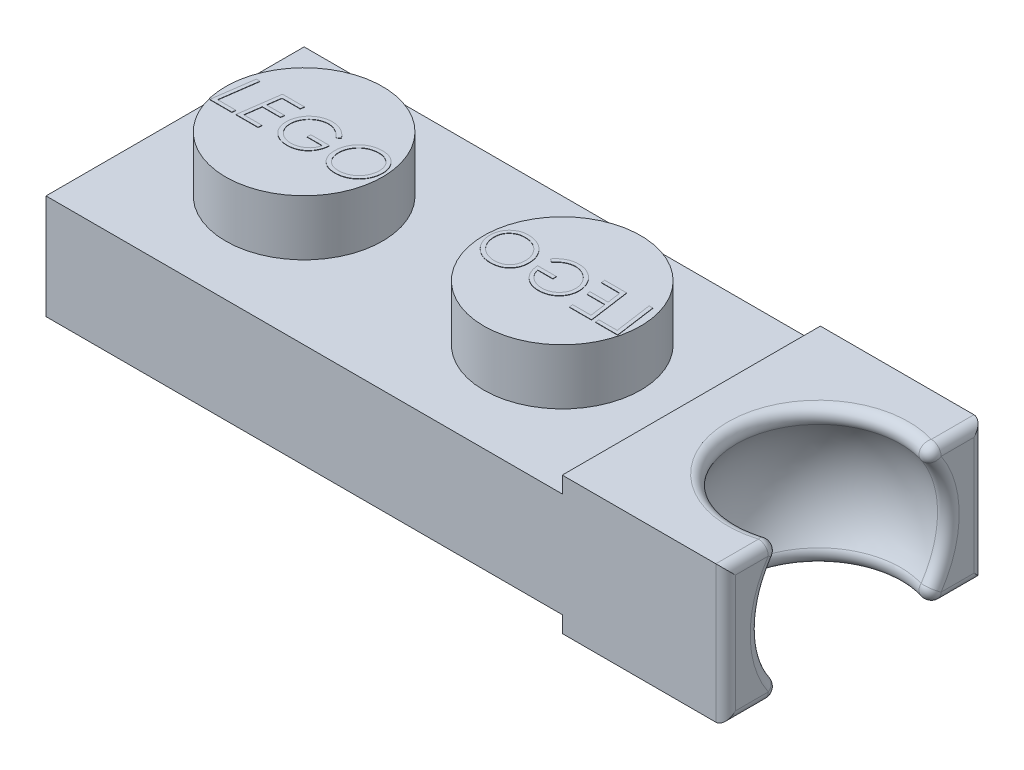
from build123d import *

# Parameters (mm, degrees)
SKETCH1_W           = 7.9
SKETCH1_H           = 7.9
BOSS_EXTRUDE1_DEPTH = 3.2
SKETCH2_R           = 2.4
BOSS_EXTRUDE2_DEPTH = 1.7
BOSS_EXTRUDE4_DEPTH = 0.01
SKETCH4_W           = 6.679581062
SKETCH4_H           = 6.679581062
CUT_EXTRUDE1_DEPTH  = 2.01
BOSS_EXTRUDE5_START = -2.01
SKETCH5_R           = 1.021947204
SKETCH5_R_2         = 1.041114876
SKETCH5_R_3         = 1.016069602
BOSS_EXTRUDE5_DEPTH = 2.01
SKETCH6_W           = 7.9
SKETCH6_H           = 4.2
BOSS_EXTRUDE6_DEPTH = 5
FILLET1_R           = 0.3


with BuildPart() as part:
    # Sketch1 → Boss-Extrude1 (new body)
    with BuildSketch(Plane(origin=(0, 0, 0), x_dir=(1, 0, 0), z_dir=(0, 1, 0))):
        with Locations((3.95, 3.95)):
            Rectangle(SKETCH1_W, SKETCH1_H)
    extrude(amount=BOSS_EXTRUDE1_DEPTH)

    # Sketch2 → Boss-Extrude2 (add)
    with BuildSketch(Plane(origin=(0, 3.2, 0), x_dir=(1, 0, 0), z_dir=(0, 1, 0))):
        with Locations((3.95, 3.95)):
            Circle(SKETCH2_R)
    extrude(amount=BOSS_EXTRUDE2_DEPTH)

    # Sketch3 → Boss-Extrude4 (add)
    # profile 1 of 4: a face of its own
    with BuildSketch(Plane(origin=(0, 4.9, 0), x_dir=(1, 0, 0), z_dir=(0, 1, 0))):
        Polygon((1.832282536, 4.604898123), (1.945463626, 4.604898123), (1.785708017, 3.46707761), (2.346104652, 3.46707761), (2.331831815, 3.354898123), (1.657002088, 3.354898123), align=None)
    # profile 2 of 4: a face of its own
    with BuildSketch(Plane(origin=(0, 4.9, 0), x_dir=(1, 0, 0), z_dir=(0, 1, 0))):
        Polygon((3.307643113, 4.604898123), (3.289864668, 4.492718636), (2.730720036, 4.492718636), (2.672376687, 4.076051969), (3.227514908, 4.076051969), (3.211489267, 3.963872482), (2.656351046, 3.963872482), (2.586990069, 3.46707761), (3.147386703, 3.46707761), (3.132863466, 3.354898123), (2.458284139, 3.354898123), (2.633564588, 4.604898123), align=None)
    # profile 3 of 4: a face of its own
    with BuildSketch(Plane(origin=(0, 4.9, 0), x_dir=(1, 0, 0), z_dir=(0, 1, 0))):
        with BuildLine():
            Line((4.701873883, 4.341727049), (4.602214428, 4.268359661))
            add(Edge.make_bspline(
                [(4.602214428, 4.268359661), (4.594223081, 4.278463296), (4.578382454, 4.298490949), (4.552974208, 4.326751799), (4.526781942, 4.353389692), (4.49925824, 4.377917229), (4.471083571, 4.40112998), (4.441525281, 4.42204341), (4.410978563, 4.441207159), (4.379659496, 4.458649755), (4.347610579, 4.474125482), (4.315396207, 4.487732834), (4.282869127, 4.498922357), (4.250283005, 4.50864136), (4.217299487, 4.51587276), (4.18414763, 4.520710487), (4.150903008, 4.524293062), (4.128633082, 4.524610402), (4.117438786, 4.524769918)],
                knots=[0, 0, 0, 0, 1.088205139, 2.157064813, 3.209299296, 4.24303109, 5.270682624, 6.292193363, 7.299904734, 8.316436989, 9.319473328, 10.305733085, 11.269264382, 12.22444877, 13.177574148, 14.119122834, 15.054550362, 16, 16, 16, 16], degree=3))
            add(Edge.make_bspline(
                [(4.117438786, 4.524769918), (4.104994375, 4.524521107), (4.080132736, 4.524024028), (4.043033101, 4.520256885), (4.006376299, 4.51354748), (3.969908323, 4.504926578), (3.933893833, 4.493301772), (3.898252767, 4.479273564), (3.86309309, 4.462612711), (3.828430169, 4.443710217), (3.794953431, 4.422557236), (3.762954424, 4.399818018), (3.733183783, 4.375017311), (3.704650221, 4.34913067), (3.678490591, 4.320990985), (3.654040353, 4.291325456), (3.631570613, 4.259970376), (3.610753816, 4.22729124), (3.592321888, 4.193377608), (3.576332398, 4.158696131), (3.562301633, 4.123622124), (3.551463822, 4.087613068), (3.542488613, 4.051135011), (3.536702509, 4.013925289), (3.532682003, 3.976230124), (3.532229884, 3.950862463), (3.532002088, 3.938081216)],
                knots=[0, 0, 0, 0, 0.97704485, 1.95195533, 2.923843304, 3.901415526, 4.89212417, 5.89249681, 6.906854198, 7.94508701, 8.99059592, 10.014519948, 11.024825533, 12.031297736, 13.037428488, 14.038509295, 15.047964276, 16.064309815, 17.079005887, 18.075937854, 19.061713623, 20.042247028, 21.026191147, 22.008802999, 22.996754876, 24, 24, 24, 24], degree=3))
            add(Edge.make_bspline(
                [(3.532002088, 3.938081216), (3.532369323, 3.920940483), (3.533092921, 3.887166428), (3.54080397, 3.83756171), (3.552297071, 3.789703796), (3.569345009, 3.743984102), (3.590663785, 3.700113704), (3.616898701, 3.658340736), (3.647995923, 3.618632516), (3.683169388, 3.581124089), (3.721975609, 3.547190184), (3.762989457, 3.517071082), (3.806208637, 3.491553815), (3.851780792, 3.471217023), (3.899058754, 3.454481236), (3.948703848, 3.443615036), (4.000192874, 3.436168993), (4.035279814, 3.435410998), (4.053085822, 3.435026328)],
                knots=[0, 0, 0, 0, 1.019699772, 2.00921373, 2.981850619, 3.945611549, 4.907936516, 5.881372837, 6.876399243, 7.906447893, 8.938173367, 9.941073143, 10.932270214, 11.919723139, 12.908225854, 13.912405215, 14.940582182, 16, 16, 16, 16], degree=3))
            add(Edge.make_bspline(
                [(4.053085822, 3.435026328), (4.074581254, 3.435599426), (4.11748625, 3.436743331), (4.180872469, 3.447608002), (4.243162184, 3.464003995), (4.303115661, 3.48756372), (4.359892332, 3.516274774), (4.411741714, 3.54979345), (4.457784869, 3.587961635), (4.498384943, 3.630580026), (4.53303885, 3.678554542), (4.563120551, 3.731230233), (4.587740602, 3.789373269), (4.599634966, 3.830601123), (4.605720036, 3.851692995)],
                knots=[0, 0, 0, 0, 1.033792167, 2.063454529, 3.086685911, 4.12966393, 5.157365104, 6.144632769, 7.094686579, 8.02963692, 8.969786061, 9.935985671, 10.944065236, 12, 12, 12, 12], degree=3))
            Line((4.605720036, 3.851692995), (4.140976447, 3.851692995))
            Line((4.140976447, 3.851692995), (4.140976447, 3.963872482))
            Line((4.140976447, 3.963872482), (4.717899524, 3.963872482))
            add(Edge.make_bspline(
                [(4.717899524, 3.963872482), (4.715864452, 3.940537279), (4.711874195, 3.894782885), (4.69942647, 3.828086612), (4.68199329, 3.764774229), (4.659173945, 3.704861641), (4.630919519, 3.648505742), (4.59774963, 3.595348644), (4.559285746, 3.545571633), (4.515814341, 3.499721655), (4.46844757, 3.458302738), (4.417878433, 3.421925394), (4.364351012, 3.391393009), (4.308182236, 3.366007973), (4.248908241, 3.346854494), (4.187007442, 3.33278705), (4.12217798, 3.324364805), (4.078067373, 3.323359246), (4.055589828, 3.322846841)],
                knots=[0, 0, 0, 0, 1.098006248, 2.152910829, 3.176693714, 4.174102283, 5.154427425, 6.128677043, 7.108165613, 8.099464247, 9.087077226, 10.054952015, 11.015803916, 11.972468591, 12.940477937, 13.931877037, 14.946141749, 16, 16, 16, 16], degree=3))
            add(Edge.make_bspline(
                [(4.055589828, 3.322846841), (4.032525547, 3.323342362), (3.987411429, 3.324311611), (3.9214857, 3.332876212), (3.858807865, 3.34620412), (3.799404334, 3.365318809), (3.743277296, 3.389857102), (3.690679177, 3.420179827), (3.641268759, 3.455657405), (3.595689928, 3.496348401), (3.554559756, 3.541197331), (3.518567584, 3.589307242), (3.487743642, 3.639999747), (3.462901044, 3.693721351), (3.443468533, 3.750181555), (3.429856098, 3.809437188), (3.421311108, 3.871476007), (3.420325278, 3.913764014), (3.419822601, 3.935326809)],
                knots=[0, 0, 0, 0, 1.117903688, 2.186638197, 3.21780727, 4.221242465, 5.20706516, 6.182431358, 7.159609539, 8.151436913, 9.139682433, 10.10533578, 11.060397566, 12.011007066, 12.969638005, 13.950363306, 14.954883424, 16, 16, 16, 16], degree=3))
            add(Edge.make_bspline(
                [(3.419822601, 3.935326809), (3.420138952, 3.950859376), (3.420767729, 3.981731803), (3.424963713, 4.027616327), (3.432679126, 4.072646659), (3.442852825, 4.116910735), (3.455965552, 4.160496846), (3.471933961, 4.20328178), (3.491087489, 4.245242481), (3.513047729, 4.286115161), (3.537530339, 4.325600602), (3.564271155, 4.363247138), (3.593498243, 4.398542313), (3.624507556, 4.432098501), (3.658146201, 4.463054417), (3.693847346, 4.491888255), (3.731480716, 4.518905381), (3.77142415, 4.543221398), (3.812846375, 4.565137356), (3.855118915, 4.584605211), (3.898469674, 4.600573637), (3.942428974, 4.613905323), (3.987291028, 4.624144078), (4.032916476, 4.631801844), (4.079465257, 4.63599767), (4.110753822, 4.636631416), (4.12645321, 4.636949405)],
                knots=[0, 0, 0, 0, 1.01034602, 2.008157081, 2.993527994, 3.979930372, 4.960683832, 5.951959865, 6.948100503, 7.958563211, 8.967975239, 9.968308804, 10.959584837, 11.946808627, 12.938010319, 13.930059161, 14.930392727, 15.949048275, 16.969091794, 17.977364349, 18.973726886, 19.971641333, 20.963333569, 21.964771492, 22.978801278, 24, 24, 24, 24], degree=3))
            add(Edge.make_bspline(
                [(4.12645321, 4.636949405), (4.140647989, 4.63666956), (4.168739982, 4.636115737), (4.210476499, 4.63288549), (4.251380819, 4.627152534), (4.29129634, 4.618801418), (4.330484053, 4.608567941), (4.368675988, 4.59577053), (4.406070924, 4.580754735), (4.442474857, 4.563343269), (4.478143584, 4.543914061), (4.512619765, 4.521658579), (4.546625807, 4.497640881), (4.579591338, 4.471153536), (4.611552577, 4.442077414), (4.642675265, 4.410871755), (4.673242279, 4.377555225), (4.692243855, 4.353777591), (4.701873883, 4.341727049)],
                knots=[0, 0, 0, 0, 1.015105213, 2.008930748, 2.991454354, 3.966534974, 4.923490216, 5.886087319, 6.844809209, 7.803252371, 8.770243484, 9.747130909, 10.735853235, 11.746297741, 12.768902994, 13.824016992, 14.897208497, 16, 16, 16, 16], degree=3))
        make_face()
    # profile 4 of 4: a face of its own
    with BuildSketch(Plane(origin=(0, 4.9, 0), x_dir=(1, 0, 0), z_dir=(0, 1, 0))):
        with BuildLine():
            add(Edge.make_bspline(
                [(5.671925966, 4.636949405), (5.692400623, 4.63650345), (5.732667893, 4.635626396), (5.791703582, 4.627669814), (5.84816478, 4.614697282), (5.901922783, 4.596339067), (5.953136821, 4.572927607), (6.001690741, 4.544284414), (6.047399306, 4.510158163), (6.09025375, 4.471611385), (6.129154607, 4.429051867), (6.163160058, 4.383201547), (6.192058383, 4.334734533), (6.215910086, 4.283554512), (6.233823478, 4.229366588), (6.246743033, 4.172603876), (6.255145963, 4.113110877), (6.255950492, 4.072491917), (6.256361062, 4.051763107)],
                knots=[0, 0, 0, 0, 1.061681398, 2.087996504, 3.083659545, 4.062660971, 5.02945529, 5.999994507, 6.981138296, 7.983640916, 8.985844288, 9.966988076, 10.939736476, 11.908342154, 12.890058995, 13.894159216, 14.925339913, 16, 16, 16, 16], degree=3))
            add(Edge.make_bspline(
                [(6.256361062, 4.051763107), (6.25623821, 4.038988627), (6.255995471, 4.01374805), (6.253408976, 3.976225127), (6.249128591, 3.939561124), (6.243455349, 3.903597875), (6.235835613, 3.868539787), (6.226924527, 3.834140064), (6.216051359, 3.800598383), (6.20384118, 3.767696929), (6.189792262, 3.735595516), (6.173946521, 3.704324105), (6.15669213, 3.673663515), (6.137607818, 3.643838863), (6.11686312, 3.614849105), (6.094393683, 3.586665409), (6.070489857, 3.559187301), (6.044887258, 3.532733386), (6.018336956, 3.507212599), (5.990529993, 3.48355884), (5.962091012, 3.461350566), (5.932834084, 3.440746086), (5.90250067, 3.422121085), (5.871581935, 3.404690573), (5.839905885, 3.388861691), (5.807185809, 3.375183309), (5.773789823, 3.362832151), (5.739620564, 3.352089492), (5.704582969, 3.343076229), (5.668762424, 3.335500733), (5.632062087, 3.329787275), (5.594535036, 3.325855801), (5.556279304, 3.323200874), (5.530454147, 3.322965537), (5.51742877, 3.322846841)],
                knots=[0, 0, 0, 0, 1.057694632, 2.089855924, 3.112648636, 4.113725536, 5.103331559, 6.082381806, 7.055068159, 8.021768845, 8.98743121, 9.954922249, 10.923671581, 11.89959402, 12.885451751, 13.874212627, 14.883322035, 15.900071676, 16.921812937, 17.931632203, 18.921551953, 19.909055848, 20.892997665, 21.867769094, 22.84762411, 23.823252803, 24.802912784, 25.795362855, 26.787788858, 27.797679081, 28.826061376, 29.861826465, 30.921574152, 32, 32, 32, 32], degree=3))
            add(Edge.make_bspline(
                [(5.51742877, 3.322846841), (5.495540081, 3.323312388), (5.45279647, 3.324221496), (5.390401025, 3.331753811), (5.331466149, 3.34468508), (5.275615882, 3.361975519), (5.223270197, 3.38492417), (5.174339628, 3.412892082), (5.128783581, 3.445910526), (5.086763869, 3.483632016), (5.049135515, 3.525626819), (5.016044394, 3.570822838), (4.988418107, 3.619388761), (4.96538613, 3.670881503), (4.948106883, 3.725740589), (4.935156589, 3.783416472), (4.927613141, 3.844314319), (4.926699871, 3.88597706), (4.926232857, 3.907281937)],
                knots=[0, 0, 0, 0, 1.121422378, 2.189881799, 3.214223923, 4.209829567, 5.180887389, 6.136870002, 7.092517675, 8.058664933, 9.02481219, 9.976998316, 10.923432162, 11.882748215, 12.86205079, 13.865508147, 14.908495107, 16, 16, 16, 16], degree=3))
            add(Edge.make_bspline(
                [(4.926232857, 3.907281937), (4.92651465, 3.92390256), (4.927073619, 3.956871533), (4.931757127, 4.005792823), (4.939128338, 4.053761359), (4.950024433, 4.100549976), (4.963594459, 4.14639076), (4.979990494, 4.191253803), (5.000003008, 4.234848241), (5.022452359, 4.277389438), (5.047513645, 4.318359564), (5.07559856, 4.356880644), (5.105216605, 4.393691441), (5.137816677, 4.42780852), (5.172496353, 4.459796588), (5.209524734, 4.489546335), (5.248906172, 4.516814917), (5.290422211, 4.541753927), (5.333531205, 4.564369022), (5.378335052, 4.583562961), (5.424193072, 4.600182058), (5.471345954, 4.613795807), (5.519847317, 4.623918047), (5.569406413, 4.631466127), (5.620254649, 4.636113027), (5.6545551, 4.636668231), (5.671925966, 4.636949405)],
                knots=[0, 0, 0, 0, 1.027038055, 2.037251559, 3.03463374, 4.024476576, 5.003805404, 5.987972729, 6.973761106, 7.966047439, 8.95963362, 9.938921687, 10.910571097, 11.877553313, 12.852319973, 13.824735949, 14.81069978, 15.81041387, 16.816403723, 17.816876174, 18.82042938, 19.829469955, 20.847307225, 21.880377804, 22.926554263, 24, 24, 24, 24], degree=3))
        make_face()
        with BuildLine():
            add(Edge.make_bspline(
                [(5.671925966, 4.524769918), (5.65697579, 4.524545747), (5.627444828, 4.524102944), (5.583747158, 4.520086709), (5.541191397, 4.514393729), (5.499970629, 4.505322476), (5.459846772, 4.494612055), (5.421182876, 4.480527241), (5.383524652, 4.464643931), (5.34726264, 4.446055377), (5.312516644, 4.425361321), (5.279529586, 4.402463835), (5.248469657, 4.377453479), (5.219370347, 4.350164922), (5.191739723, 4.321307483), (5.166361885, 4.289965789), (5.142845474, 4.256628787), (5.121196386, 4.221501346), (5.10164712, 4.185107003), (5.08492909, 4.147719282), (5.070612165, 4.109847114), (5.058744989, 4.071497155), (5.049737471, 4.032481304), (5.043287884, 3.99291855), (5.039049877, 3.95269661), (5.03862585, 3.92565532), (5.038412344, 3.912039549)],
                knots=[0, 0, 0, 0, 1.093710758, 2.16039807, 3.20900896, 4.233234191, 5.246749975, 6.245527847, 7.241594159, 8.235879922, 9.224691631, 10.198908654, 11.171861231, 12.139893662, 13.116290872, 14.093089164, 15.087825051, 16.099756899, 17.110766713, 18.108591704, 19.094380672, 20.071961556, 21.043859171, 22.021859724, 23.00397114, 24, 24, 24, 24], degree=3))
            add(Edge.make_bspline(
                [(5.038412344, 3.912039549), (5.038625982, 3.900599914), (5.039049193, 3.877938292), (5.041777549, 3.844392517), (5.046595514, 3.811801965), (5.053065301, 3.780081073), (5.061542906, 3.749273697), (5.072183234, 3.719394567), (5.084405544, 3.690349568), (5.098393626, 3.662290632), (5.114175341, 3.635553687), (5.131389377, 3.61020951), (5.150226394, 3.586682218), (5.170360361, 3.564729612), (5.191972025, 3.544421151), (5.214980987, 3.52555365), (5.239648771, 3.508615875), (5.265465573, 3.492943288), (5.292687864, 3.479247808), (5.321165948, 3.467438697), (5.350786278, 3.457432665), (5.381544214, 3.449135171), (5.413524888, 3.442928532), (5.44663118, 3.438448028), (5.480905707, 3.435639812), (5.504152208, 3.435232585), (5.515926367, 3.435026328)],
                knots=[0, 0, 0, 0, 1.083699529, 2.146780792, 3.185591126, 4.202843058, 5.211856999, 6.209655863, 7.20532214, 8.195415879, 9.177202942, 10.14436246, 11.095191523, 12.029705806, 12.963818608, 13.902338257, 14.845476191, 15.796042213, 16.761390084, 17.729066592, 18.714222808, 19.721158958, 20.74459932, 21.797962164, 22.884686177, 24, 24, 24, 24], degree=3))
            add(Edge.make_bspline(
                [(5.515926367, 3.435026328), (5.530044188, 3.435228857), (5.558004277, 3.435629962), (5.599524853, 3.440000997), (5.64032433, 3.445959686), (5.680325762, 3.455225454), (5.71965402, 3.466535035), (5.757982705, 3.481070895), (5.795756024, 3.497476377), (5.83237428, 3.51683082), (5.867802238, 3.538111172), (5.901266528, 3.561837848), (5.932774032, 3.587459191), (5.962816859, 3.614626895), (5.990234918, 3.644356353), (6.016009711, 3.675809964), (6.039684501, 3.709331455), (6.061465654, 3.744601276), (6.080935982, 3.781209824), (6.097718361, 3.818903041), (6.112024773, 3.857287248), (6.123844079, 3.896320217), (6.132886835, 3.936161865), (6.139301688, 3.976648339), (6.14355343, 4.017951988), (6.143970816, 4.04574289), (6.144181575, 4.059775927)],
                knots=[0, 0, 0, 0, 1.029812959, 2.039525905, 3.043952503, 4.036919093, 5.033391511, 6.027870106, 7.026035071, 8.036794627, 9.047957848, 10.039952554, 11.027355318, 12.010276797, 12.992858524, 13.975534638, 14.976019862, 15.985163142, 16.99876328, 17.999396818, 18.993875413, 19.986244033, 20.973271002, 21.972624612, 22.976275263, 24, 24, 24, 24], degree=3))
            add(Edge.make_bspline(
                [(6.144181575, 4.059775927), (6.143688983, 4.077993105), (6.142724583, 4.113658826), (6.13551886, 4.16576722), (6.122807184, 4.214771606), (6.105892747, 4.261149785), (6.083400704, 4.304354629), (6.056090597, 4.344736825), (6.024020374, 4.382453222), (5.999069145, 4.404451295), (5.986429171, 4.415595238)],
                knots=[0, 0, 0, 0, 1.085318323, 2.124844004, 3.126009127, 4.096923137, 5.060061729, 6.020100862, 6.997008382, 8, 8, 8, 8], degree=3))
            add(Edge.make_bspline(
                [(5.986429171, 4.415595238), (5.97539623, 4.42431843), (5.953439426, 4.44167857), (5.917982347, 4.463870828), (5.881057133, 4.482788681), (5.842389242, 4.498145486), (5.802091847, 4.510165945), (5.760106575, 4.518646998), (5.716539836, 4.523741692), (5.686963766, 4.524423338), (5.671925966, 4.524769918)],
                knots=[0, 0, 0, 0, 0.992364662, 1.974918139, 2.947382948, 3.917989177, 4.907989082, 5.912266894, 6.938502841, 8, 8, 8, 8], degree=3))
        make_face(mode=Mode.SUBTRACT)
    extrude(amount=BOSS_EXTRUDE4_DEPTH)

    # Sketch4 → Cut-Extrude1 (cut)
    with BuildSketch(Plane.XZ):
        with Locations((3.960209469, -3.960209469)):
            Rectangle(SKETCH4_W, SKETCH4_H)
    extrude(amount=-CUT_EXTRUDE1_DEPTH, mode=Mode.SUBTRACT)

    # Sketch5 → Boss-Extrude5 (add)
    with BuildSketch(Plane(origin=(0, 3.2, 0), x_dir=(1, 0, 0), z_dir=(0, 1, 0)).offset(BOSS_EXTRUDE5_START)):
        with Locations((1.458127833, 1.557811677)):
            Circle(SKETCH5_R)
        with Locations((1.458127833, 6.365232327)):
            Circle(SKETCH5_R_2)
        with BuildLine():
            ThreePointArc((5.605437996, 2.21232194), (7.084971092, 0.850452311), (5.706377057, 2.31441459))
            ThreePointArc((5.706377057, 2.31441459), (5.656671092, 2.262613327), (5.605437996, 2.21232194))
        make_face()
        with Locations((6.369527619, 6.365232327)):
            Circle(SKETCH5_R_3)
    extrude(amount=BOSS_EXTRUDE5_DEPTH)

    # Mirror1: part across plane


with BuildPart() as part_1:
    add(part.part)
    add(part.part.mirror(Plane(origin=(7.9, 3.2, 0), x_dir=(0, 0, 1), z_dir=(-1, 0, 0))))

    # Sketch6 → Boss-Extrude6 (add)
    with BuildSketch(Plane(origin=(15.8, 0, 0), x_dir=(0, 0, -1), z_dir=(1, 0, 0))):
        with Locations((3.95, 1.6)):
            Rectangle(SKETCH6_W, SKETCH6_H)
    extrude(amount=BOSS_EXTRUDE6_DEPTH)

    # Sketch13 → Cut-Revolve1 (revolve, cut)
    with BuildSketch(Plane(origin=(0, 1.6, 0), x_dir=(1, 0, 0), z_dir=(0, 1, 0))):
        with BuildLine():
            Line((19.688949017, 0.95), (19.688949017, 6.95))
            ThreePointArc((19.688949017, 6.95), (16.688949017, 3.95), (19.688949017, 0.95))
        make_face()
    revolve(axis=Axis((19.688949017, 1.6, -0.95), (0, 0, -1)), mode=Mode.SUBTRACT)

    # Fillet1
    fillet1_edges = [part_1.edges().sort_by_distance(p)[0] for p in [
        (20.8, 3.7, -6.840910164),
        (20.8, 1.6, -7.9),
        (20.8, -0.5, -6.840910164),
        (20.8, -0.5, -1.059089836),
        (20.8, 3.7, -1.059089836),
        (20.8, 1.6, 0),
        (17.546520488, -0.5, -3.95),
        (20.8, 1.6, -6.736676463),
        (17.546520488, 3.7, -3.95),
        (20.8, 1.6, -1.163323537),
    ]]
    fillet(fillet1_edges, radius=FILLET1_R)


solid = part_1.part
